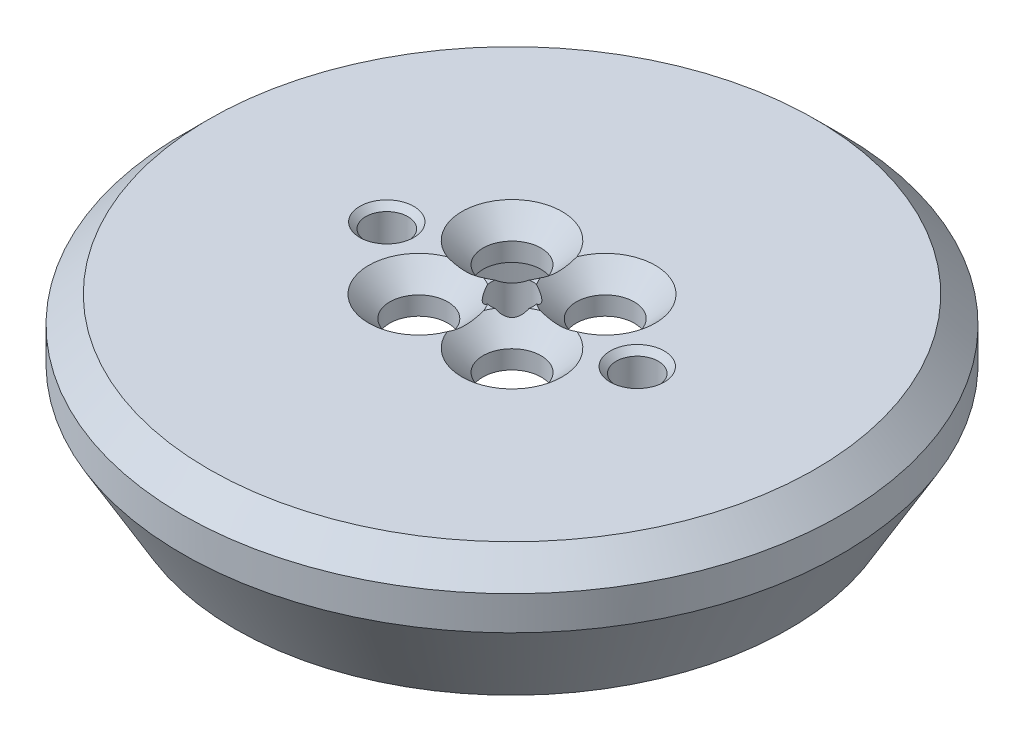
from build123d import *

# Parameters (mm, degrees)
SKETCH1_R                                       = 12.5
BOSS_EXTRUDE1_DEPTH                             = 1.5
CUT_EXTRUDE1_DEPTH                              = 18.741194999
CUT_EXTRUDE1_DEPTH_BACK                         = 18.741194999
SKETCH2_R                                       = 0.8
CSK_FOR_M2_FLAT_HEAD_MACHINE_SCREW1_D           = 2.2
CSK_FOR_M2_FLAT_HEAD_MACHINE_SCREW1_DEPTH       = 5
CSK_FOR_M2_FLAT_HEAD_MACHINE_SCREW1_CSINK_D     = 3.8
CSK_FOR_M2_FLAT_HEAD_MACHINE_SCREW1_CSINK_ANGLE = 90
CSK_FOR_M2_FLAT_HEAD_MACHINE_SCREW1_TIP         = 0.660946681
BOSS_EXTRUDE2_START                             = 3
SKETCH7_R                                       = 12.5
SKETCH7_R_2                                     = 7.2
BOSS_EXTRUDE2_DEPTH                             = 3
FILLET1_R                                       = 1
CHAMFER1_SIZE                                   = 1
CHAMFER2_SIZE                                   = 1
CHAMFER3_SIZE                                   = 2
CHAMFER3_SIZE2                                  = 3.464101615
M2X0_4_TAPPED_HOLE1_D                           = 1.6
M2X0_4_TAPPED_HOLE1_DEPTH                       = 5.2
M2X0_4_TAPPED_HOLE1_CSINK_D                     = 2.05
M2X0_4_TAPPED_HOLE1_CSINK_ANGLE                 = 90
M2X0_4_TAPPED_HOLE1_TIP                         = 0.480688495


with BuildPart() as part:
    # Sketch1 → Boss-Extrude1 (new body)
    with BuildSketch(Plane(origin=(0, 0, 0), x_dir=(1, 0, 0), z_dir=(0, 1, 0))):
        Circle(SKETCH1_R)
    extrude(amount=BOSS_EXTRUDE1_DEPTH)

    # Sketch2 → Cut-Extrude1 (cut, two sides: drawn at the far end of the back side and taken through both)
    with BuildSketch(Plane(origin=(0, 1.5, 0), x_dir=(1, 0, 0), z_dir=(0, 1, 0)).offset(-CUT_EXTRUDE1_DEPTH_BACK)):
        Circle(SKETCH2_R)
    extrude(amount=CUT_EXTRUDE1_DEPTH + CUT_EXTRUDE1_DEPTH_BACK, mode=Mode.SUBTRACT)

    # CSK for M2 Flat Head Machine Screw1
    with Locations(Plane(origin=(0, 1.5, 0), x_dir=(1, 0, 0), z_dir=(0, 1, 0))):
        with Locations((-1.767766953, 1.767766953), (1.767766953, 1.767766953), (1.767766953, -1.767766953), (-1.767766953, -1.767766953)):
            CounterSinkHole(CSK_FOR_M2_FLAT_HEAD_MACHINE_SCREW1_D / 2, CSK_FOR_M2_FLAT_HEAD_MACHINE_SCREW1_CSINK_D / 2, depth=CSK_FOR_M2_FLAT_HEAD_MACHINE_SCREW1_DEPTH, counter_sink_angle=CSK_FOR_M2_FLAT_HEAD_MACHINE_SCREW1_CSINK_ANGLE)
            with Locations((0, 0, -(CSK_FOR_M2_FLAT_HEAD_MACHINE_SCREW1_DEPTH + CSK_FOR_M2_FLAT_HEAD_MACHINE_SCREW1_TIP / 2))):  # 118° drill point
                Cone(0, CSK_FOR_M2_FLAT_HEAD_MACHINE_SCREW1_D / 2, CSK_FOR_M2_FLAT_HEAD_MACHINE_SCREW1_TIP, mode=Mode.SUBTRACT)

    # Sketch6 → Revolve1 (revolve)
    with BuildSketch(Plane.XY):
        Polygon((-12.5, 0), (-12.5, -1.25), (-7.2, -1.25), (-5, 0), align=None)
    revolve(axis=Axis((0, 0, 0), (0, -1, 0)))

    # Sketch7 → Boss-Extrude2 (add)
    with BuildSketch(Plane.XZ.offset(1.25).offset(BOSS_EXTRUDE2_START)):
        Circle(SKETCH7_R)
        Circle(SKETCH7_R_2, mode=Mode.SUBTRACT)
    extrude(amount=-BOSS_EXTRUDE2_DEPTH)

    # Fillet1
    fillet1_edges = [part.edges().sort_by_distance(p)[0] for p in [
        (5, 0, 0),
        (0, -1.25, 7.2),
    ]]
    fillet(fillet1_edges, radius=FILLET1_R)

    # Chamfer1
    chamfer1_edges = [part.edges().sort_by_distance(p)[0] for p in [
        (-12.5, 1.5, 0),
    ]]
    chamfer(chamfer1_edges, length=CHAMFER1_SIZE)

    # Chamfer2
    chamfer2_edges = [part.edges().sort_by_distance(p)[0] for p in [
        (-7.2, -4.25, 0),
    ]]
    chamfer(chamfer2_edges, length=CHAMFER2_SIZE)

    # Chamfer3
    chamfer3_edges = [part.edges().sort_by_distance(p)[0] for p in [
        (-12.5, -4.25, 0),
    ]]
    chamfer3_side = [part.faces().sort_by_distance(p)[0] for p in [
        (-8.553553391, -4.25, 0),
    ]]
    chamfer(chamfer3_edges, length=CHAMFER3_SIZE, length2=CHAMFER3_SIZE2, reference=chamfer3_side[0])

    # M2x0.4 Tapped Hole1
    with Locations(Plane(origin=(0, 1.5, 0), x_dir=(1, 0, 0), z_dir=(0, 1, 0))):
        with Locations((-4.75, 0), (4.75, 0)):
            CounterSinkHole(M2X0_4_TAPPED_HOLE1_D / 2, M2X0_4_TAPPED_HOLE1_CSINK_D / 2, depth=M2X0_4_TAPPED_HOLE1_DEPTH, counter_sink_angle=M2X0_4_TAPPED_HOLE1_CSINK_ANGLE)
            with Locations((0, 0, -(M2X0_4_TAPPED_HOLE1_DEPTH + M2X0_4_TAPPED_HOLE1_TIP / 2))):  # 118° drill point
                Cone(0, M2X0_4_TAPPED_HOLE1_D / 2, M2X0_4_TAPPED_HOLE1_TIP, mode=Mode.SUBTRACT)


solid = part.part
